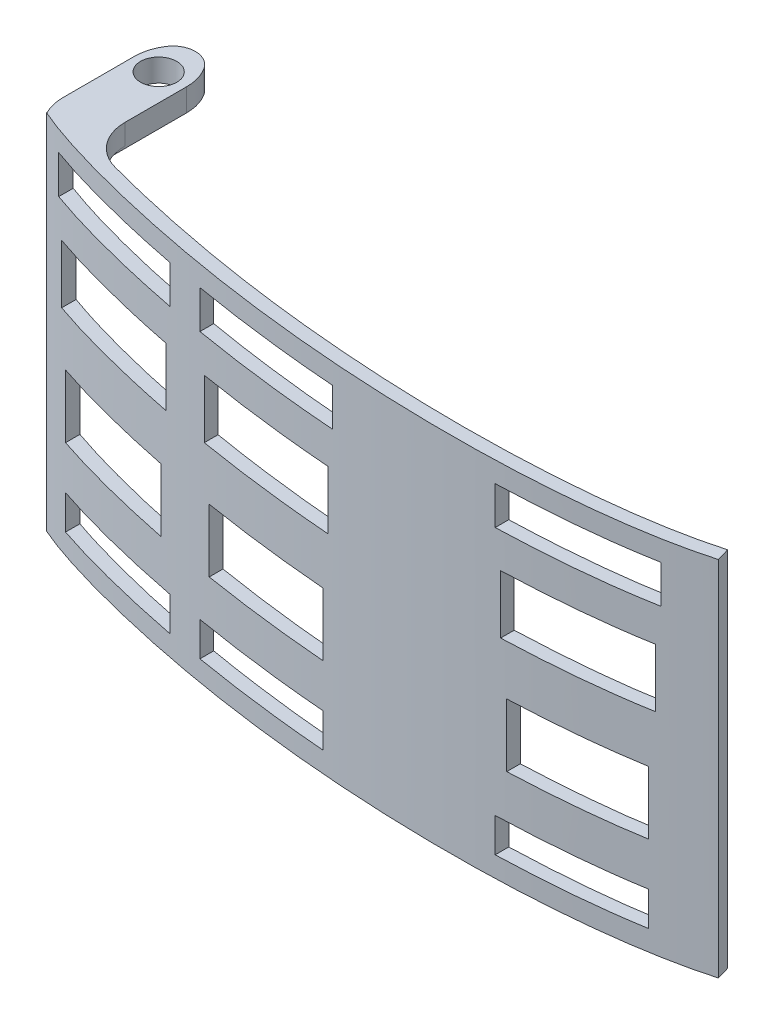
from build123d import *

# Parameters (mm, degrees)
BOSS_EXTRUDE1_DEPTH     = 80
CUT_EXTRUDE1_DEPTH      = 144.537715686
CUT_EXTRUDE1_DEPTH_BACK = 144.537715686
SKETCH2_W               = 33.306633731
SKETCH2_H               = 8.399064158
SKETCH2_W_2             = 31.134461966
SKETCH2_H_2             = 12.888219139
SKETCH2_W_3             = 28.527855848
SKETCH2_H_3             = 13.901899296
SKETCH2_W_4             = 30.989650515
SKETCH2_H_4             = 7.530195452
SKETCH2_W_5             = 28.527855849
SKETCH2_W_6             = 30.989650516
SKETCH2_W_7             = 31.134461967
SKETCH2_W_8             = 33.306633732
SKETCH3_R               = 4
BOSS_EXTRUDE2_DEPTH     = 5
FILLET1_R               = 10
FILLET2_R               = 10
FILLET3_R               = 5


with BuildPart() as part:
    # Sketch1 → Boss-Extrude1 (new body)
    with BuildSketch(Plane(origin=(0, 0, 0), x_dir=(1, 0, 0), z_dir=(0, 1, 0))):
        with BuildLine():
            Line((-41.87644139, -1.489985742), (-40.672611913, 1.257885177))
            add(Edge.make_bspline(
                [(-40.672611913, 1.257885177), (-40.427971679, 1.150709428), (-39.945120698, 0.943384866), (-38.909562654, 0.514982735), (-37.532089439, -0.025367908), (-35.741591319, -0.684199256), (-33.187495966, -1.570449772), (-29.700795031, -2.68735423), (-25.110186392, -4.023608119), (-20.173145713, -5.339570541), (-13.207785584, -7.046241913), (-3.92575144, -9.053081201), (7.655302078, -11.136167193), (23.157314294, -13.352116862), (42.468680871, -15.127692562), (60.998461594, -15.666370393), (74.950531801, -15.415694912), (84.875738831, -14.902110383), (94.158774393, -14.07896279), (101.27217087, -13.149049101), (106.534665294, -12.268431968), (110.25502713, -11.541914011), (113.149106081, -10.885541813), (115.345541006, -10.328193057), (116.381791833, -10.045105719), (116.905534952, -9.896473621)],
                knots=[0, 0, 0, 0, 0.0078125, 0.015625, 0.03125, 0.046875, 0.0625, 0.09375, 0.125, 0.15625, 0.1875, 0.25, 0.3125, 0.375, 0.5, 0.625, 0.6875, 0.75, 0.8125, 0.875, 0.90625, 0.9375, 0.96875, 0.984375, 1, 1, 1, 1], degree=3))
            Line((116.905534952, -9.896473621), (117.724557706, -12.782509263))
            add(Edge.make_bspline(
                [(-41.87644139, -1.489985742), (-32.093131832, -5.776008185), (29.237099237, -21.621532061), (93.937806592, -19.532907671), (117.724557706, -12.782509263)],
                knots=[0, 0, 0, 0, 0.302600264, 1, 1, 1, 1], degree=3))
        make_face()
    extrude(amount=BOSS_EXTRUDE1_DEPTH)

    # Sketch2 → Cut-Extrude1 (cut, two sides: drawn at the far end of the back side and taken through both)
    with BuildSketch(Plane.XY.offset(-CUT_EXTRUDE1_DEPTH_BACK)):
        with Locations((-20.688027694, 71.282370289)):
            Rectangle(SKETCH2_W, SKETCH2_H)
        with Locations((-20.760433419, 52.963721737)):
            Rectangle(SKETCH2_W_2, SKETCH2_H_2)
        with Locations((-20.760433419, 28.562992242)):
            Rectangle(SKETCH2_W_3, SKETCH2_H_3)
        with Locations((-19.529536086, 8.289389101)):
            Rectangle(SKETCH2_W_4, SKETCH2_H_4)
        with Locations((19.529536086, 8.289389101)):
            Rectangle(SKETCH2_W_4, SKETCH2_H_4)
        with Locations((20.760433419, 28.562992242)):
            Rectangle(SKETCH2_W_3, SKETCH2_H_3)
        with Locations((20.760433419, 52.963721737)):
            Rectangle(SKETCH2_W_2, SKETCH2_H_2)
        with Locations((20.688027694, 71.282370289)):
            Rectangle(SKETCH2_W, SKETCH2_H)
        with Locations((90.809156105, 28.562992242)):
            Rectangle(SKETCH2_W_5, SKETCH2_H_3)
        with Locations((89.578258772, 8.289389101)):
            Rectangle(SKETCH2_W_6, SKETCH2_H_4)
        with Locations((90.809156105, 52.963721737)):
            Rectangle(SKETCH2_W_7, SKETCH2_H_2)
        with Locations((90.73675038, 71.282370289)):
            Rectangle(SKETCH2_W_8, SKETCH2_H)
    extrude(amount=CUT_EXTRUDE1_DEPTH + CUT_EXTRUDE1_DEPTH_BACK, mode=Mode.SUBTRACT)

    # Sketch3 → Boss-Extrude2 (add)
    with BuildSketch(Plane(origin=(0, 80, 0), x_dir=(1, 0, 0), z_dir=(0, 1, 0))):
        Polygon((-42.89069437, -1.203620542), (-31.313374957, -2.599467563), (-31.313374957, 28.930697737), (-42.89069437, 28.930697737), align=None)
        with Locations(Location((-37.254707612, 18.680489609, 0), (0, 0, 270))):
            Circle(SKETCH3_R, mode=Mode.SUBTRACT)
    extrude(amount=-BOSS_EXTRUDE2_DEPTH)

    # Fillet1
    fillet1_edges = [part.edges().sort_by_distance(p)[0] for p in [
        (-31.313374957, 77.740951184, 2.164369239),
    ]]
    fillet(fillet1_edges, radius=FILLET1_R)

    # Fillet2
    # the kernel refuses this fillet: 10 mm, written as the material it takes off along each edge
    with BuildSketch(Plane(origin=(-42.89069437, 90.987058479, 1.203620542), x_dir=(0, 0, -1), z_dir=(0, -1, 0))) as fillet2_piece_1:
        with BuildLine():
            CenterArc((4.394823392, 10), FILLET2_R, 243.093613708, 26.906386292)
            Line((-0.130517687, 1.082529051), (-0.221024509, 0.904179632))
            ThreePointArc((-0.221024509, 0.904179632), (-0.263820853, 0.517324425), (-0.198562009, -0.0239401))
            Line((-0.198562009, -0.0239401), (0, -0.2))
            Line((0, -0.2), (4.394823392, -0.2))
            Line((4.394823392, -0.2), (4.394823392, 0))
        make_face()
    extrude(amount=26.974116959, mode=Mode.SUBTRACT)
    with BuildSketch(Plane(origin=(-42.89069437, 105, -28.930697737), x_dir=(1, 0, 0), z_dir=(0, -1, 0)), Plane(origin=(-31.313374957, 105, -28.930697737), x_dir=(0, 0, 1), z_dir=(0, -1, 0))) as fillet2_piece_2:
        with BuildLine():
            CenterArc((FILLET2_R, FILLET2_R), FILLET2_R, 180, 90)
            Line((0, FILLET2_R), (-FILLET2_R * 0.02, FILLET2_R))
            Line((-FILLET2_R * 0.02, FILLET2_R), (-FILLET2_R * 0.02, -FILLET2_R * 0.02))
            Line((-FILLET2_R * 0.02, -FILLET2_R * 0.02), (FILLET2_R, -FILLET2_R * 0.02))
            Line((FILLET2_R, -FILLET2_R * 0.02), (FILLET2_R, 0))
        make_face()
    extrude(amount=55, mode=Mode.SUBTRACT)

    # Fillet3
    fillet3_edges = [part.edges().sort_by_distance(p)[0] for p in [
        (-37.102034663, 77.5, -28.000681912),
    ]]
    fillet(fillet3_edges, radius=FILLET3_R)


solid = part.part
